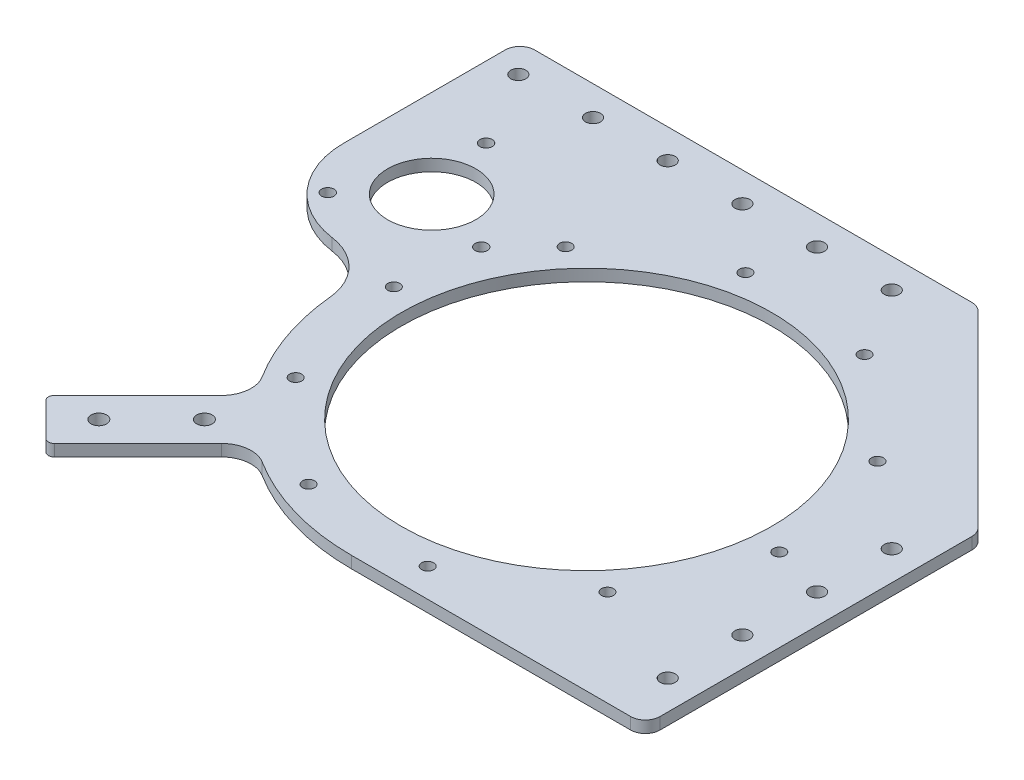
from build123d import *

# Parameters (mm, degrees)
SKETCH_1_R               = 80
SKETCH_1_R_2             = 63
EXTRUDE_1_DEPTH          = 4
EXTRUDE_START            = -4
EXTRUDE_2_DEPTH          = 4
SKETCH_3_R               = 2.1
CUT_EXTRUDE_1_DEPTH      = 10
SKETCH_4_R               = 2.05
CUT_EXTRUDE_2_DEPTH      = 10
PATTERN_CIRCULAR_1_COUNT = 10
SKETCH_5_W               = 20
SKETCH_5_H               = 113.13708499
SKETCH_5_W_2             = 155.80242317
SKETCH_5_H_2             = 20
EXTRUDE_3_DEPTH          = 4
SKETCH_6_R               = 2.55
CUT_EXTRUDE_3_DEPTH      = 10
FILLET_1_R               = 20
SKETCH_7_R               = 15
CUT_EXTRUDE_4_DEPTH      = 10
FILLET_2_R               = 5
SKETCH_8_W               = 256.678769512
SKETCH_8_H               = 176.797047192
CUT_EXTRUDE_5_DEPTH      = 290
EXTRUDE_4_DEPTH          = 4
FILLET_3_R               = 10
FILLET_4_R               = 2
CUT_EXTRUDE_6_DEPTH      = 10


with BuildPart() as part:
    # 草图1 → 凸台-拉伸1 (new body)
    # profile 1 of 5: a face of its own
    with BuildSketch(Plane(origin=(0, 0, 0), x_dir=(1, 0, 0), z_dir=(0, 1, 0))):
        with BuildLine():
            ThreePointArc((0, -80), (-56.568542608, -56.568542382), (-80, 3.2e-07))
            Line((-80, 3.2e-07), (-80, -80))
            Line((-80, -80), (0, -80))
        make_face()
    # profile 2 of 5: a face of its own
    with BuildSketch(Plane(origin=(0, 0, 0), x_dir=(1, 0, 0), z_dir=(0, 1, 0))):
        Circle(SKETCH_1_R)
        with Locations(Location((0, 0, 0), (0, 0, 270))):
            Circle(SKETCH_1_R_2, mode=Mode.SUBTRACT)
    # profile 3 of 5: a face of its own
    with BuildSketch(Plane(origin=(0, 0, 0), x_dir=(1, 0, 0), z_dir=(0, 1, 0))):
        with BuildLine():
            ThreePointArc((-80, 3.2e-07), (-73.91036254, 30.614674737), (-56.568542495, 56.568542495))
            Line((-56.568542495, 56.568542495), (-80, 33.13708499))
            Line((-80, 33.13708499), (-80, 3.2e-07))
        make_face()
    # profile 4 of 5: a face of its own
    with BuildSketch(Plane(origin=(0, 0, 0), x_dir=(1, 0, 0), z_dir=(0, 1, 0))):
        with BuildLine():
            Line((0, 80), (-33.13708499, 80))
            Line((-33.13708499, 80), (-56.568542495, 56.568542495))
            ThreePointArc((-56.568542495, 56.568542495), (-30.614674589, 73.910362601), (0, 80))
        make_face()
    # profile 5 of 5: a face of its own
    with BuildSketch(Plane(origin=(0, 0, 0), x_dir=(1, 0, 0), z_dir=(0, 1, 0))):
        with BuildLine():
            Line((80, 80), (0, 80))
            ThreePointArc((0, 80), (56.568542495, 56.568542495), (80, 0))
            Line((80, 0), (80, 80))
        make_face()
    extrude(amount=EXTRUDE_1_DEPTH)


with BuildPart() as body_2:
    # 草图2 → 凸台-拉伸2 (new body)
    with BuildSketch(Plane(origin=(0, 4, 0), x_dir=(1, 0, 0), z_dir=(0, 1, 0)).offset(EXTRUDE_START)):
        with BuildLine():
            Line((122.66533818, 80), (80, 80))
            Line((80, 80), (80, 10))
            Line((80, 10), (92.66533818, 10))
            ThreePointArc((92.66533818, 10), (113.878541616, 18.786796564), (122.66533818, 40))
            Line((122.66533818, 40), (122.66533818, 80))
        make_face()
    extrude(amount=EXTRUDE_2_DEPTH)


with BuildPart() as part_1:
    add(part.part)

    # Combine 5: union body 2
    add(body_2.part)

    # 草图3 → 切除-拉伸1 (cut)
    with BuildSketch(Plane(origin=(0, 4, 0), x_dir=(1, 0, 0), z_dir=(0, 1, 0))):
        with Locations(Location((98.488743184, 64.31230047, 0), (0, 0, 270))):
            Circle(SKETCH_3_R)
        with Locations(Location((110.808705509, 22.800633094, 0), (0, 0, 270))):
            Circle(SKETCH_3_R)
        with Locations(Location((68.698565846, 32.887066435, 0), (0, 0, 270))):
            Circle(SKETCH_3_R)
    extrude(amount=-CUT_EXTRUDE_1_DEPTH, mode=Mode.SUBTRACT)

    # 草图4 → 切除-拉伸2 (cut)
    with BuildSketch(Plane(origin=(0, 4, 0), x_dir=(1, 0, 0), z_dir=(0, 1, 0))):
        with Locations(Location((-71.825637732, -6.283929052, 0), (0, 0, 270))):
            Circle(SKETCH_4_R)
    cut_extrude_2 = extrude(amount=-CUT_EXTRUDE_2_DEPTH, mode=Mode.SUBTRACT)

    # 阵列(圆周)1: 切除-拉伸2 ×10 about axis
    pattern_circular_1_axis = Axis((0, 0, 0), (0, 1, 0))
    for i in range(1, PATTERN_CIRCULAR_1_COUNT):
        add(cut_extrude_2.rotate(pattern_circular_1_axis, i * 360 / PATTERN_CIRCULAR_1_COUNT), mode=Mode.SUBTRACT)

    # 草图5 → 凸台-拉伸3 (add)
    with BuildSketch(Plane(origin=(0, 4, 0), x_dir=(1, 0, 0), z_dir=(0, 1, 0))):
        with Locations((-90, -23.431457505)):
            Rectangle(SKETCH_5_W, SKETCH_5_H)
        Polygon((-33.13708499, 80), (-33.13708499, 100), (-100, 33.13708499), (-80, 33.13708499), align=None)
        with Locations((44.764126595, 90)):
            Rectangle(SKETCH_5_W_2, SKETCH_5_H_2)
    extrude(amount=-EXTRUDE_3_DEPTH)

    # 草图6 → 切除-拉伸3 (cut)
    with BuildSketch(Plane(origin=(0, 4, 0), x_dir=(1, 0, 0), z_dir=(0, 1, 0))):
        with Locations(Location((-13.8, 90, 0), (0, 0, 270))):
            Circle(SKETCH_6_R)
        with Locations(Location((11.6, 90, 0), (0, 0, 270))):
            Circle(SKETCH_6_R)
        with Locations(Location((37, 90, 0), (0, 0, 270))):
            Circle(SKETCH_6_R)
        with Locations(Location((62.4, 90, 0), (0, 0, 270))):
            Circle(SKETCH_6_R)
        with Locations(Location((87.8, 90, 0), (0, 0, 270))):
            Circle(SKETCH_6_R)
        with Locations(Location((113.2, 90, 0), (0, 0, 270))):
            Circle(SKETCH_6_R)
        with Locations(Location((-90, 13.8, 0), (0, 0, 270))):
            Circle(SKETCH_6_R)
        with Locations(Location((-90, -11.6, 0), (0, 0, 270))):
            Circle(SKETCH_6_R)
        with Locations(Location((-90, -37, 0), (0, 0, 270))):
            Circle(SKETCH_6_R)
        with Locations(Location((-90, -62.4, 0), (0, 0, 270))):
            Circle(SKETCH_6_R)
    extrude(amount=-CUT_EXTRUDE_3_DEPTH, mode=Mode.SUBTRACT)

    # 圆角1
    fillet_1_edges = [part_1.edges().sort_by_distance(p)[0] for p in [
        (80, 2, -10),
    ]]
    fillet(fillet_1_edges, radius=FILLET_1_R)

    # 草图7 → 切除-拉伸4 (cut)
    with BuildSketch(Plane(origin=(0, 4, 0), x_dir=(1, 0, 0), z_dir=(0, 1, 0))):
        with Locations(Location((92.66533818, 40, 0), (0, 0, 270))):
            Circle(SKETCH_7_R)
    extrude(amount=-CUT_EXTRUDE_4_DEPTH, mode=Mode.SUBTRACT)

    # 圆角2
    fillet_2_edges = [part_1.edges().sort_by_distance(p)[0] for p in [
        (-100, 2, 80),
        (-100, 2, -33.13708499),
        (-33.13708499, 2, -100),
        (122.66533818, 2, -100),
    ]]
    fillet(fillet_2_edges, radius=FILLET_2_R)


with BuildPart() as body_2_2:
    # 镜向2: mirrored copy
    add(part_1.part.mirror(Plane(origin=(132.66533818, 0, 0), x_dir=(0, 0, 1), z_dir=(1, 0, 0))))

    # 草图9 → 凸台-拉伸4 (add)
    with BuildSketch(Plane(origin=(0, 4, 0), x_dir=(1, 0, 0), z_dir=(0, 1, 0))):
        with BuildLine():
            Line((166.335726994, -84.852813742), (180.477862617, -98.994949366))
            Line((180.477862617, -98.994949366), (216.27688337, -63.195928613))
            ThreePointArc((216.27688337, -63.195928613), (208.762133865, -56.568542495), (202.134747746, -49.05379299))
            Line((202.134747746, -49.05379299), (166.335726994, -84.852813742))
        make_face()
    extrude(amount=-EXTRUDE_4_DEPTH)

    # 圆角3
    fillet_3_edges = [body_2_2.edges().sort_by_distance(p)[0] for p in [
        (202.134747746, 2, 49.05379299),
        (216.27688337, 2, 63.195928613),
    ]]
    fillet(fillet_3_edges, radius=FILLET_3_R)

    # 圆角4
    fillet_4_edges = [body_2_2.edges().sort_by_distance(p)[0] for p in [
        (166.335726994, 2, 84.852813742),
        (180.477862617, 2, 98.994949366),
    ]]
    fillet(fillet_4_edges, radius=FILLET_4_R)

    # 草图10 → 切除-拉伸6 (cut)
    with BuildSketch(Plane(origin=(0, 4, 0), x_dir=(1, 0, 0), z_dir=(0, 1, 0))):
        with BuildLine():
            ThreePointArc((202.221396139, -63.109280221), (198.473730199, -63.109280221), (198.473730199, -66.856946161))
            Line((198.473730199, -66.856946161), (202.221396139, -63.109280221))
        make_face()
        with BuildLine():
            Line((202.221396139, -63.109280221), (198.473730199, -66.856946161))
            ThreePointArc((198.473730199, -66.856946161), (201.361674265, -67.431393952), (202.997563169, -64.983113191))
            ThreePointArc((202.997563169, -64.983113191), (202.79584393, -63.969002095), (202.221396139, -63.109280221))
        make_face()
        with BuildLine():
            ThreePointArc((184.260883897, -81.069792463), (180.513217957, -81.069792463), (180.513217957, -84.817458403))
            Line((180.513217957, -84.817458403), (184.260883897, -81.069792463))
        make_face()
        with BuildLine():
            Line((184.260883897, -81.069792463), (180.513217957, -84.817458403))
            ThreePointArc((180.513217957, -84.817458403), (183.401162022, -85.391906194), (185.037050927, -82.943625433))
            ThreePointArc((185.037050927, -82.943625433), (184.835331688, -81.929514337), (184.260883897, -81.069792463))
        make_face()
    extrude(amount=-CUT_EXTRUDE_6_DEPTH, mode=Mode.SUBTRACT)


with BuildPart() as part_2:
    add(part_1.part)

    # 草图8 → 切除-拉伸5 (cut)
    with BuildSketch(Plane(origin=(132.66533818, 0, 0), x_dir=(0, 0, -1), z_dir=(1, 0, 0))):
        with Locations((25.923800224, 29.064395705)):
            Rectangle(SKETCH_8_W, SKETCH_8_H)
    extrude(amount=-CUT_EXTRUDE_5_DEPTH, mode=Mode.SUBTRACT)


solid = body_2_2.part
